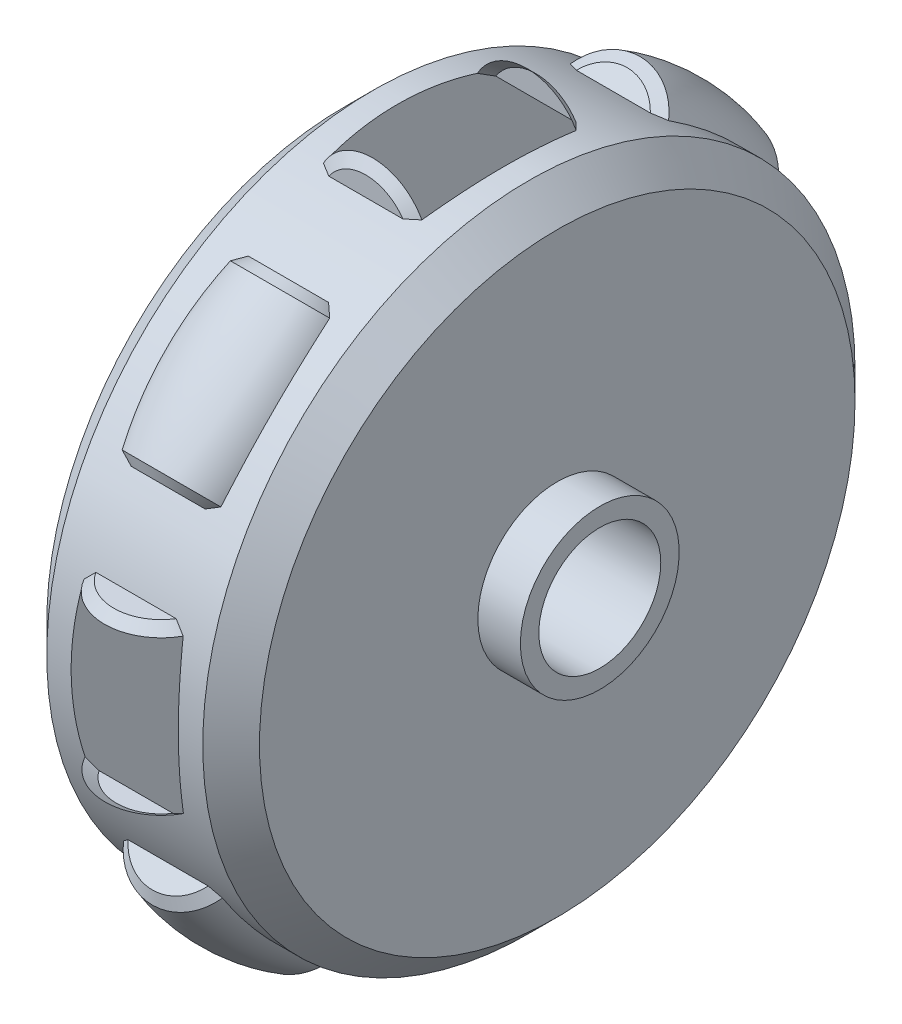
from build123d import *

# Parameters (mm, degrees)
SKETCH_1_R       = 23
SKETCH_1_R_2     = 4.3
EXTRUDE_1_DEPTH  = 7.5
SKETCH_2_R       = 5.6
SKETCH_2_R_2     = 4.3
EXTRUDE_2_DEPTH  = 10.5
CHAMFER_2_SIZE   = 0.5
CHAMFER_2_SIZE_2 = 0.684207102
CHAMFER_1_SIZE   = 2


with BuildPart() as part:
    # 草图1 → 凸台-拉伸1 (new, symmetric)
    with BuildSketch(Plane(origin=(0, 0, 0), x_dir=(0, -1, 0), z_dir=(1, 0, 0))):
        with Locations(Location((0, 0, 0), (0, 0, 90))):
            Circle(SKETCH_1_R)
        with Locations(Location((0, 0, 0), (0, 0, 90))):
            Circle(SKETCH_1_R_2, mode=Mode.SUBTRACT)
    extrude(amount=EXTRUDE_1_DEPTH, both=True)

    # 草图2 → 凸台-拉伸2 (add, symmetric)
    with BuildSketch(Plane(origin=(0, 0, 0), x_dir=(0, -1, 0), z_dir=(1, 0, 0))):
        with Locations(Location((0, 0, 0), (0, 0, 270))):
            Circle(SKETCH_2_R)
        with Locations(Location((0, 0, 0), (0, 0, 90))):
            Circle(SKETCH_2_R_2, mode=Mode.SUBTRACT)
    extrude(amount=EXTRUDE_2_DEPTH, both=True)

    # 草图3 → 旋转1 (revolve)
    with BuildSketch(Plane(origin=(0, 0, 0), x_dir=(0, -1, 0), z_dir=(1, 0, 0))):
        with BuildLine():
            Line((-6, 20.430237462), (6, 20.430237462))
            Line((6, 20.430237462), (6, 24.269322199))
            ThreePointArc((6, 24.269322199), (0, 25), (-6, 24.269322199))
            Line((-6, 24.269322199), (-6, 20.430237462))
        make_face()
    revolve(axis=Axis((0, 6, -20.430237462), (0, -1, 0)))

    # 倒角2
    # the kernel refuses this chamfer: 0.684207102, 0.5 mm, written as the material it takes off along each edge
    with BuildSketch(Plane(origin=(0, -6, -20.430237462), x_dir=(0, 0, -1), z_dir=(-1, 0, 0))) as chamfer_2_piece_1_section:
        with BuildLine():
            Line((3.991030159, -0.651945422), (3.839084737 - CHAMFER_2_SIZE, 0))
            Line((3.839084737 - CHAMFER_2_SIZE, 0), (3.839084737, 0))
            ThreePointArc((3.839084737, 0), (3.919874011, -0.336779078), (3.991030159, -0.651945422))
        make_face()
    chamfer_2_piece_1 = revolve(axis=Axis((0, -6, -20.430237462), (0, -1, 0)), revolution_arc=88.342927662, mode=Mode.PRIVATE)
    chamfer_2_piece_1 = chamfer_2_piece_1 - Plane(origin=(0, 0, 0), x_dir=(0, 0, -1), z_dir=(1, 0, 0)) * Cylinder(23, 16, mode=Mode.PRIVATE)
    add(chamfer_2_piece_1, mode=Mode.SUBTRACT)
    with BuildSketch(Plane(origin=(0, 6, -20.430237462), x_dir=(-0.999816255751859, 0, -0.01916910885600484), z_dir=(-0.01916910885600484, 0, 0.999816255751859))) as chamfer_2_piece_2_section:
        with BuildLine():
            Line((3.953148434, 0.481803535), (3.839084737 - CHAMFER_2_SIZE_2, 0))
            Line((3.839084737 - CHAMFER_2_SIZE_2, 0), (3.839084737, 0))
            ThreePointArc((3.839084737, 0), (3.899513793, 0.249938798), (3.953148434, 0.481803535))
        make_face()
    chamfer_2_piece_2 = revolve(axis=Axis((0, 6, -20.430237462), (0, -1, 0)), revolution_arc=88.901623691, mode=Mode.PRIVATE)
    chamfer_2_piece_2 = chamfer_2_piece_2 - Plane(origin=(0, 0, 0), x_dir=(0, 0, -1), z_dir=(1, 0, 0)) * Cylinder(23, 16, mode=Mode.PRIVATE)
    add(chamfer_2_piece_2, mode=Mode.SUBTRACT)
    with BuildSketch(Plane(origin=(0, 6, -20.430237462), x_dir=(0, 0, -1), z_dir=(-1, 0, 0))) as chamfer_2_piece_3_section:
        with BuildLine():
            Line((3.839084737 - CHAMFER_2_SIZE_2, 0), (3.953148434, 0.481803535))
            ThreePointArc((3.953148434, 0.481803535), (3.899513793, 0.249938798), (3.839084737, 0))
            Line((3.839084737, 0), (3.839084737 - CHAMFER_2_SIZE_2, 0))
        make_face()
    chamfer_2_piece_3 = revolve(axis=Axis((0, 6, -20.430237462), (0, -1, 0)), revolution_arc=88.901623691, mode=Mode.PRIVATE)
    chamfer_2_piece_3 = chamfer_2_piece_3 - Plane(origin=(0, 0, 0), x_dir=(0, 0, -1), z_dir=(1, 0, 0)) * Cylinder(23, 16, mode=Mode.PRIVATE)
    add(chamfer_2_piece_3, mode=Mode.SUBTRACT)
    with BuildSketch(Plane(origin=(0, -6, -20.430237462), x_dir=(-0.9995818063806323, 0, -0.028917336544571383), z_dir=(-0.028917336544571383, 0, 0.9995818063806323))) as chamfer_2_piece_4_section:
        with BuildLine():
            Line((3.991030159, -0.651945422), (3.839084737 - CHAMFER_2_SIZE, 0))
            Line((3.839084737 - CHAMFER_2_SIZE, 0), (3.839084737, 0))
            ThreePointArc((3.839084737, 0), (3.919874011, -0.336779078), (3.991030159, -0.651945422))
        make_face()
    chamfer_2_piece_4 = revolve(axis=Axis((0, -6, -20.430237462), (0, -1, 0)), revolution_arc=88.342927662, mode=Mode.PRIVATE)
    chamfer_2_piece_4 = chamfer_2_piece_4 - Plane(origin=(0, 0, 0), x_dir=(0, 0, -1), z_dir=(1, 0, 0)) * Cylinder(23, 16, mode=Mode.PRIVATE)
    add(chamfer_2_piece_4, mode=Mode.SUBTRACT)

    # 阵列(圆周)1: read off the stored shape, not the designer's step
    # 阵列(圆周)1 outline → 阵列(圆周)1 (revolve)
    with BuildSketch(Plane.XY.offset(20.430237462)):
        with BuildLine():
            Line((3.339084737, 6), (1.773365849, 6))
            Line((1.773365849, 6), (1.773365849, -6))
            Line((1.773365849, -6), (3.154877634, -6))
            Line((3.154877634, -6), (3.953148338, -5.518196893))
            ThreePointArc((3.953148338, -5.518196893), (4.56961062, -0.08715419), (3.991030141, 5.348054657))
            Line((3.991030141, 5.348054657), (3.339084737, 6))
        make_face()
    revolve(axis=Axis((0, 0, 20.430237462), (0, 1, 0)))

    # Pattern Circular 1 2 outline → Pattern Circular 1 2 (revolve)
    with BuildSketch(Plane(origin=(0, -14.446359451, -14.446359451), x_dir=(1, 0, 0), z_dir=(0, 0.707106781186549, 0.707106781186546))):
        with BuildLine():
            Line((3.154877634, 6), (1.773365849, 6))
            Line((1.773365849, 6), (1.773365849, -6))
            Line((1.773365849, -6), (3.339084737, -6))
            Line((3.339084737, -6), (3.991030123, -5.348054743))
            ThreePointArc((3.991030123, -5.348054743), (4.569610621, 0.087154009), (3.953148398, 5.518196625))
            Line((3.953148398, 5.518196625), (3.154877634, 6))
        make_face()
    revolve(axis=Axis((0, -14.446359451, -14.446359451), (0, 0.707106781186546, -0.707106781186549)))

    # Pattern Circular 1 3 outline → Pattern Circular 1 3 (revolve)
    with BuildSketch(Plane(origin=(0, 14.446359451, 14.446359451), x_dir=(1, 0, 0), z_dir=(0, 0.707106781186554, 0.707106781186541))):
        with BuildLine():
            Line((3.339084737, 6), (1.773365849, 6))
            Line((1.773365849, 6), (1.773365849, -6))
            Line((1.773365849, -6), (3.154877634, -6))
            Line((3.154877634, -6), (3.953148398, -5.518196625))
            ThreePointArc((3.953148398, -5.518196625), (4.569610621, -0.087154009), (3.991030123, 5.348054743))
            Line((3.991030123, 5.348054743), (3.339084737, 6))
        make_face()
    revolve(axis=Axis((0, 14.446359451, 14.446359451), (0, 0.707106781186541, -0.707106781186554)))

    # Pattern Circular 1 4 outline → Pattern Circular 1 4 (revolve)
    with BuildSketch(Plane.XZ.offset(20.430237462)):
        with BuildLine():
            Line((1.773365849, 6), (1.773365849, -6))
            Line((1.773365849, -6), (3.154877634, -6))
            Line((3.154877634, -6), (3.953148338, -5.518196893))
            ThreePointArc((3.953148338, -5.518196893), (4.56961062, -0.08715419), (3.991030141, 5.348054657))
            Line((3.991030141, 5.348054657), (3.339084737, 6))
            Line((3.339084737, 6), (1.773365849, 6))
        make_face()
    revolve(axis=Axis((0, -20.430237462, 0), (0, 0, 1)))

    # Pattern Circular 1 5 outline → Pattern Circular 1 5 (revolve)
    with BuildSketch(Plane.XZ.offset(-20.430237462)):
        with BuildLine():
            Line((1.773365849, 6), (1.773365849, -6))
            Line((1.773365849, -6), (3.339084737, -6))
            Line((3.339084737, -6), (3.991030141, -5.348054657))
            ThreePointArc((3.991030141, -5.348054657), (4.56961062, 0.08715419), (3.953148338, 5.518196893))
            Line((3.953148338, 5.518196893), (3.154877634, 6))
            Line((3.154877634, 6), (1.773365849, 6))
        make_face()
    revolve(axis=Axis((0, 20.430237462, 0), (0, 0, 1)))

    # Pattern Circular 1 6 outline → Pattern Circular 1 6 (revolve)
    with BuildSketch(Plane(origin=(0, -14.446359451, 14.446359451), x_dir=(1, 0, 0), z_dir=(0, -0.7071067811865441, 0.7071067811865511))):
        with BuildLine():
            Line((1.773365849, 6), (1.773365849, -6))
            Line((1.773365849, -6), (3.154877634, -6))
            Line((3.154877634, -6), (3.953148398, -5.518196625))
            ThreePointArc((3.953148398, -5.518196625), (4.569610621, -0.087154009), (3.991030123, 5.348054743))
            Line((3.991030123, 5.348054743), (3.339084737, 6))
            Line((3.339084737, 6), (1.773365849, 6))
        make_face()
    revolve(axis=Axis((0, -14.446359451, 14.446359451), (0, 0.7071067811865511, 0.7071067811865441)))

    # Pattern Circular 1 7 outline → Pattern Circular 1 7 (revolve)
    with BuildSketch(Plane(origin=(0, 14.446359451, -14.446359451), x_dir=(1, 0, 0), z_dir=(0, -0.707106781186539, 0.707106781186556))):
        with BuildLine():
            Line((1.773365849, 6), (1.773365849, -6))
            Line((1.773365849, -6), (3.339084737, -6))
            Line((3.339084737, -6), (3.991030123, -5.348054743))
            ThreePointArc((3.991030123, -5.348054743), (4.569610621, 0.087154009), (3.953148398, 5.518196625))
            Line((3.953148398, 5.518196625), (3.154877634, 6))
            Line((3.154877634, 6), (1.773365849, 6))
        make_face()
    revolve(axis=Axis((0, 14.446359451, -14.446359451), (0, 0.707106781186556, 0.707106781186539)))

    # 倒角1
    chamfer_1_edges = [part.edges().sort_by_distance(p)[0] for p in [
        (-7.5, 0, 23),
        (7.5, 0, 23),
    ]]
    chamfer(chamfer_1_edges, length=CHAMFER_1_SIZE)


solid = part.part
